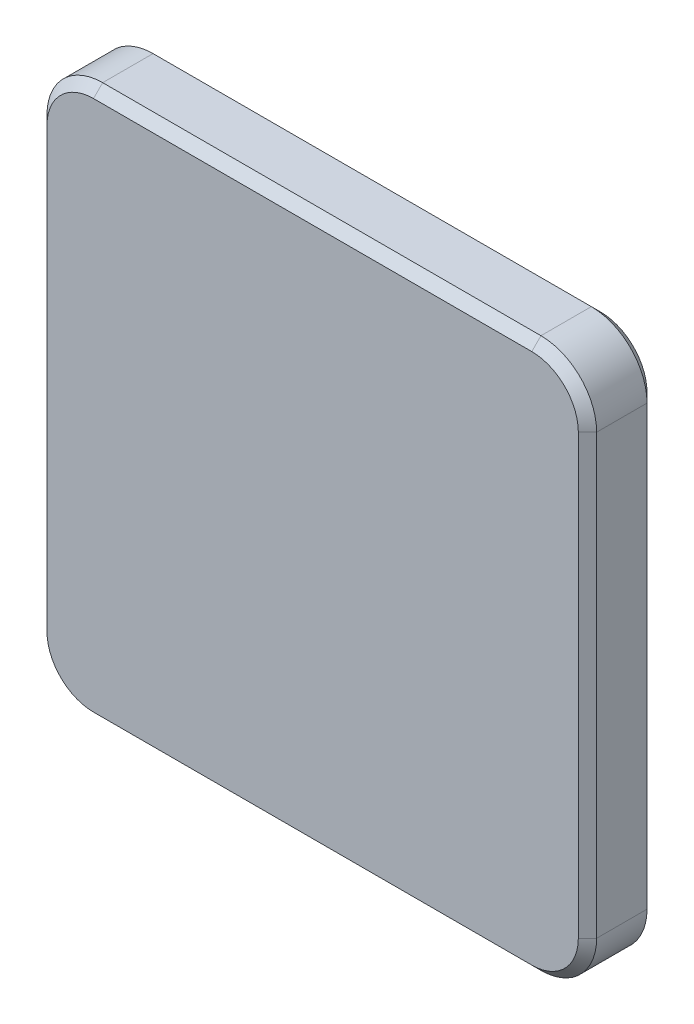
from build123d import *

# Parameters (mm, degrees)
SKETCH3_W                         = 101.6
SKETCH3_H                         = 12.7
BOSS_EXTRUDE1_DEPTH               = 50.8
BASEBORDERRADIUSSKETCH_OUTSIDE_W  = 132.436
BASEBORDERRADIUSSKETCH_OUTSIDE_H  = 132.436
BASEBORDERRADIUSCUT_EXTRUDE_DEPTH = 73.821966391
BASECHAMFER_SIZE                  = 1.5875
BUMPERTHREAD_PITCH                = 0.79375
BUMPERTHREADLPATTERN_COUNT        = 2
BUMPERTHREADLPATTERN_PITCH        = 76.2
BUMPERTHREADLPATTERN_COUNT_DIR2   = 2
BUMPERTHREADLPATTERN_PITCH_DIR2   = 76.2
BUMPERINSETSKETCH_R               = 6.35
BUMPERCUTS_DEPTH                  = 4.7625
LOGOCUTEXTRUDE_DEPTH              = 1.5875
CHAMFER1_SIZE                     = 0.396875


with BuildPart() as part:
    # Sketch3 → Boss-Extrude1 (new, symmetric)
    with BuildSketch(Plane(origin=(0, 0, 0), x_dir=(1, 0, 0), z_dir=(0, 1, 0))):
        Rectangle(SKETCH3_W, SKETCH3_H)
    extrude(amount=BOSS_EXTRUDE1_DEPTH, both=True)

    # FacingBottomSurfaceCut
    split(bisect_by=Plane(origin=(0, 0, -5.953125), x_dir=(1, 0, 0), z_dir=(0, 0, -1)), keep=Keep.BOTTOM)

    # FacingTopSurfaceCut
    split(bisect_by=Plane(origin=(0, 0, 5.953125), x_dir=(-1, 0, 0), z_dir=(0, 0, 1)), keep=Keep.BOTTOM)

    # BaseBorderRadiusSketch outside → BaseBorderRadiusCut-Extrude (cut, through all)
    with BuildSketch(Plane(origin=(0, 0, -5.953125), x_dir=(1, 0, 0), z_dir=(0, 0, -1))):
        Rectangle(BASEBORDERRADIUSSKETCH_OUTSIDE_W, BASEBORDERRADIUSSKETCH_OUTSIDE_H)
        with BuildLine():
            Line((-47.625, 37.973), (-47.625, -37.973))
            ThreePointArc((-47.625, -37.973), (-44.797994652, -44.797994652), (-37.973, -47.625))
            Line((-37.973, -47.625), (37.973, -47.625))
            ThreePointArc((37.973, -47.625), (44.797994652, -44.797994652), (47.625, -37.973))
            Line((47.625, -37.973), (47.625, 37.973))
            ThreePointArc((47.625, 37.973), (44.797994652, 44.797994652), (37.973, 47.625))
            Line((37.973, 47.625), (-37.973, 47.625))
            ThreePointArc((-37.973, 47.625), (-44.797994652, 44.797994652), (-47.625, 37.973))
        make_face(mode=Mode.SUBTRACT)
    extrude(amount=-BASEBORDERRADIUSCUT_EXTRUDE_DEPTH, mode=Mode.SUBTRACT)

    # BaseChamfer
    basechamfer_edges = [part.edges().sort_by_distance(p)[0] for p in [
        (0, -47.625, 5.953125),
        (-44.797994652, -44.797994652, 5.953125),
        (-47.625, 0, 5.953125),
        (-44.797994652, 44.797994652, 5.953125),
        (0, 47.625, 5.953125),
        (44.797994652, 44.797994652, 5.953125),
        (47.625, 0, 5.953125),
        (44.797994652, -44.797994652, 5.953125),
        (-44.797994652, -44.797994652, -5.953125),
        (0, -47.625, -5.953125),
        (44.797994652, -44.797994652, -5.953125),
        (47.625, 0, -5.953125),
        (44.797994652, 44.797994652, -5.953125),
        (0, 47.625, -5.953125),
        (-44.797994652, 44.797994652, -5.953125),
        (-47.625, 0, -5.953125),
    ]]
    chamfer(basechamfer_edges, length=BASECHAMFER_SIZE)

    # Sketch11 → Bumper#6-32 Tapped Hole (revolve, cut)
    with BuildSketch(Plane(origin=(-38.1, 38.1, -5.953125), x_dir=(0, 1, 0), z_dir=(1, 0, 0))):
        Polygon((0, 0), (0, 9.54394403), (1.35255, 8.73125), (1.35255, 0), align=None)
    bumper_6_32_tapped_hole = revolve(axis=Axis((-38.1, 38.1, -12.303125), (0, 0, 1)), mode=Mode.SUBTRACT)

    # BumperThread: the profile of Thread Profile1 profile screwed along a right-hand helix of 12 turns, 8 arcs to a turn; built about Z, then put on its axis
    bumperthread_z = Axis((0, 0, 0), (0, 0, 1))
    bumperthread_corners = [(1.35225, 0, -0.000173205), (1.782179788, 0, 0.248046874), (1.782179788, 0, 0.347265624), (1.35225, 0, 0.595485703)]
    with BuildLine(mode=Mode.PRIVATE) as bumperthread_profile:
        Line(bumperthread_corners[0], bumperthread_corners[1])
        Line(bumperthread_corners[1], bumperthread_corners[2])
        Line(bumperthread_corners[2], bumperthread_corners[3])
        Line(bumperthread_corners[3], bumperthread_corners[0])
    bumperthread_cap = Face(bumperthread_profile.wire())
    bumperthread_turn_angles = [0, 22.5, 45, 67.5, 90, 112.5, 135, 157.5, 180, 202.5, 225, 247.5, 270, 292.5, 315, 337.5, 360]
    bumperthread_turn_weights = [1, 0.9238795325112867, 1, 0.9238795325112867, 1, 0.9238795325112867, 1, 0.9238795325112867, 1, 0.9238795325112867, 1, 0.9238795325112867, 1, 0.9238795325112867, 1, 0.9238795325112867, 1]
    bumperthread_turn_rails = [Edge.make_bspline([Vector(p[0], p[1], 0).rotate(bumperthread_z, bumperthread_turn_angles[k]) / bumperthread_turn_weights[k] + Vector(0, 0, p[2] + BUMPERTHREAD_PITCH * bumperthread_turn_angles[k] / 360) for k in range(17)], [0, 0, 0, 1, 1, 2, 2, 3, 3, 4, 4, 5, 5, 6, 6, 7, 7, 8, 8, 8], 2, bumperthread_turn_weights) for p in bumperthread_corners]
    bumperthread_turn_sides = [Face.make_surface_from_curves(bumperthread_turn_rails[p[0]], bumperthread_turn_rails[p[1]]) for p in [(0, 1), (1, 2), (2, 3), (3, 0)]]
    bumperthread = Plane(origin=(-38.1, 38.1, -6.746875), x_dir=(1, 0, 0), z_dir=(0, 0, 1)) * Solid(Shell([*[p.moved(Location((0, 0, BUMPERTHREAD_PITCH * i))) for i in range(12) for p in bumperthread_turn_sides], bumperthread_cap, bumperthread_cap.rotate(bumperthread_z, 4320).moved(Location((0, 0, BUMPERTHREAD_PITCH * 4320 / 360)))]))
    add(bumperthread, mode=Mode.SUBTRACT)

    # BumperThreadLPattern: Bumper#6-32 Tapped Hole, BumperThread 2 × 2
    with Locations(*[(i * BUMPERTHREADLPATTERN_PITCH, -j * BUMPERTHREADLPATTERN_PITCH_DIR2, 0) for i in range(BUMPERTHREADLPATTERN_COUNT) for j in range(BUMPERTHREADLPATTERN_COUNT_DIR2) if (i, j) != (0, 0)]):
        add(bumper_6_32_tapped_hole, mode=Mode.SUBTRACT)
        add(bumperthread, mode=Mode.SUBTRACT)

    # BumperInsetSketch → BumperCuts (cut)
    with BuildSketch(Plane.XY.offset(-5.953125)):
        with Locations(Location((-38.1, 38.1, 0), (0, 0, 180))):
            Circle(BUMPERINSETSKETCH_R)
        with Locations(Location((38.1, 38.1, 0), (0, 0, 180))):
            Circle(BUMPERINSETSKETCH_R)
        with Locations(Location((38.1, -38.1, 0), (0, 0, 180))):
            Circle(BUMPERINSETSKETCH_R)
        with Locations(Location((-38.1, -38.1, 0), (0, 0, 180))):
            Circle(BUMPERINSETSKETCH_R)
    extrude(amount=BUMPERCUTS_DEPTH, mode=Mode.SUBTRACT)

    # LogoSketch → LogoCutExtrude (cut)
    # profile 1 of 5: a face of its own
    with BuildSketch(Plane.XY.offset(-5.953125)):
        with BuildLine():
            Line((4.533680299, -4.248779361), (-4.533680299, -4.248779361))
            ThreePointArc((-4.533680299, -4.248779361), (-6.217478322, -3.551327384), (-6.914930299, -1.867529361))
            Line((-6.914930299, -1.867529361), (-6.914930299, 1.965294255))
            ThreePointArc((-6.914930299, 1.965294255), (-6.217478322, 3.649092278), (-4.533680299, 4.346544255))
            Line((-4.533680299, 4.346544255), (4.533680299, 4.346544255))
            ThreePointArc((4.533680299, 4.346544255), (6.217478322, 3.649092278), (6.914930299, 1.965294255))
            Line((6.914930299, 1.965294255), (6.914930299, -1.867529361))
            ThreePointArc((6.914930299, -1.867529361), (6.217478322, -3.551327384), (4.533680299, -4.248779361))
        make_face()
        with BuildLine():
            Line((4.533680299, -3.455029361), (-4.533680299, -3.455029361))
            ThreePointArc((-4.533680299, -3.455029361), (-5.656212314, -2.990061376), (-6.121180299, -1.867529361))
            Line((-6.121180299, -1.867529361), (-6.121180299, 1.965294255))
            ThreePointArc((-6.121180299, 1.965294255), (-5.656212314, 3.08782627), (-4.533680299, 3.552794255))
            Line((-4.533680299, 3.552794255), (4.533680299, 3.552794255))
            ThreePointArc((4.533680299, 3.552794255), (5.656212314, 3.08782627), (6.121180299, 1.965294255))
            Line((6.121180299, 1.965294255), (6.121180299, -1.867529361))
            ThreePointArc((6.121180299, -1.867529361), (5.656212314, -2.990061376), (4.533680299, -3.455029361))
        make_face(mode=Mode.SUBTRACT)
    # profile 2 of 5: a face of its own
    with BuildSketch(Plane.XY.offset(-5.953125)):
        with BuildLine():
            Line((-4.084958262, 0.465465281), (-3.745847603, 0.217418406))
            Line((-3.745847603, 0.217418406), (-4.107384418, -0.317411431))
            add(Edge.make_bspline(
                [(-4.107384418, -0.317411431), (-4.117731467, -0.333055261), (-4.136865481, -0.361984212), (-4.158090193, -0.405326), (-4.172527983, -0.444038294), (-4.174461041, -0.469088497), (-4.175342466, -0.480510747)],
                knots=[0, 0, 0, 0, 0.313971844, 0.580604376, 0.808766356, 1, 1, 1, 1], degree=3))
            add(Edge.make_bspline(
                [(-4.175342466, -0.480510747), (-4.174372616, -0.497202362), (-4.172433547, -0.530574757), (-4.154090327, -0.57858004), (-4.125328234, -0.62349711), (-4.087260419, -0.664557891), (-4.042311595, -0.699569508), (-3.993277146, -0.725891806), (-3.94068621, -0.741559074), (-3.904745079, -0.743754394), (-3.886520762, -0.744867553)],
                knots=[0, 0, 0, 0, 0.116072961, 0.232070568, 0.353538763, 0.486654939, 0.620706194, 0.749385024, 0.872923124, 1, 1, 1, 1], degree=3))
            add(Edge.make_bspline(
                [(-3.886520762, -0.744867553), (-3.870661023, -0.743795189), (-3.838879432, -0.74164626), (-3.794253595, -0.720437767), (-3.75207772, -0.689440793), (-3.729786672, -0.660808178), (-3.717984803, -0.645648803)],
                knots=[0, 0, 0, 0, 0.232858362, 0.466628673, 0.717609594, 1, 1, 1, 1], degree=3))
            Line((-3.717984803, -0.645648803), (-3.690122003, -0.606233135))
            Line((-3.690122003, -0.606233135), (-3.153933005, 0.156256163))
            Line((-3.153933005, 0.156256163), (-2.898410745, -0.452647947))
            add(Edge.make_bspline(
                [(-2.898410745, -0.452647947), (-2.888024277, -0.475772536), (-2.86817581, -0.519963461), (-2.831841489, -0.579846527), (-2.791903006, -0.630388935), (-2.748285392, -0.672080262), (-2.701393576, -0.705662229), (-2.649542781, -0.72775488), (-2.594742342, -0.7422332), (-2.556903487, -0.743976214), (-2.53755351, -0.744867553)],
                knots=[0, 0, 0, 0, 0.15358312, 0.29349625, 0.423478163, 0.542965227, 0.6584056, 0.770941816, 0.882864567, 1, 1, 1, 1], degree=3))
            add(Edge.make_bspline(
                [(-2.53755351, -0.744867553), (-2.521871125, -0.743993454), (-2.491251454, -0.742286786), (-2.446927306, -0.731577769), (-2.407120441, -0.711926975), (-2.371562303, -0.686296898), (-2.342444824, -0.654546062), (-2.321085127, -0.618688258), (-2.307125895, -0.579591782), (-2.305807832, -0.552210937), (-2.305136986, -0.538275087)],
                knots=[0, 0, 0, 0, 0.136148641, 0.265828609, 0.392432725, 0.519036841, 0.644259947, 0.763265011, 0.879510543, 1, 1, 1, 1], degree=3))
            add(Edge.make_bspline(
                [(-2.305136986, -0.538275087), (-2.305464465, -0.526906054), (-2.306158645, -0.502806313), (-2.314632812, -0.466165493), (-2.325131743, -0.426317526), (-2.336055885, -0.399980385), (-2.341834332, -0.38604906)],
                knots=[0, 0, 0, 0, 0.216030294, 0.457934648, 0.713268464, 1, 1, 1, 1], degree=3))
            Line((-2.341834332, -0.38604906), (-2.36765839, -0.324886817))
            Line((-2.36765839, -0.324886817), (-3.357127568, 2.071313954))
            Line((-3.357127568, 2.071313954), (-3.382272046, 2.132476197))
            add(Edge.make_bspline(
                [(-3.382272046, 2.132476197), (-3.391301945, 2.152656351), (-3.408656071, 2.191439617), (-3.441527855, 2.243612452), (-3.478610894, 2.287691587), (-3.519221938, 2.324305223), (-3.564704183, 2.351721429), (-3.613147041, 2.372812299), (-3.666498429, 2.384222401), (-3.703211611, 2.385819337), (-3.722062286, 2.386639296)],
                knots=[0, 0, 0, 0, 0.146264449, 0.281098591, 0.406705968, 0.526791125, 0.64127443, 0.756892036, 0.875174279, 1, 1, 1, 1], degree=3))
            add(Edge.make_bspline(
                [(-3.722062286, 2.386639296), (-3.737782144, 2.385906791), (-3.768591504, 2.384471155), (-3.812594616, 2.371678636), (-3.853400851, 2.351552349), (-3.889217265, 2.323149541), (-3.919704575, 2.2898136), (-3.942390739, 2.252085808), (-3.955730991, 2.210603925), (-3.957156452, 2.181726215), (-3.957876712, 2.167134801)],
                knots=[0, 0, 0, 0, 0.131610018, 0.257942557, 0.381164227, 0.511159338, 0.638983625, 0.758259388, 0.877852595, 1, 1, 1, 1], degree=3))
            add(Edge.make_bspline(
                [(-3.957876712, 2.167134801), (-3.957541367, 2.155316969), (-3.956832271, 2.130327859), (-3.948489753, 2.091997072), (-3.937040367, 2.050560236), (-3.926203391, 2.022749847), (-3.920499786, 2.008112969)],
                knots=[0, 0, 0, 0, 0.215420924, 0.455513061, 0.713431243, 1, 1, 1, 1], degree=3))
            Line((-3.920499786, 2.008112969), (-3.893996147, 1.945591565))
            Line((-3.893996147, 1.945591565), (-3.293926584, 0.496725983))
            Line((-3.293926584, 0.496725983), (-3.807689426, 0.876611471))
            add(Edge.make_bspline(
                [(-3.807689426, 0.876611471), (-3.833167937, 0.894380442), (-3.880688749, 0.927521936), (-3.952251465, 0.965833269), (-4.018940223, 0.989482182), (-4.062155899, 0.993152658), (-4.08223994, 0.994858474)],
                knots=[0, 0, 0, 0, 0.306944426, 0.572492185, 0.801320142, 1, 1, 1, 1], degree=3))
            add(Edge.make_bspline(
                [(-4.08223994, 0.994858474), (-4.097731555, 0.994112488), (-4.127593803, 0.992674494), (-4.170220235, 0.980464788), (-4.209105934, 0.961411467), (-4.242723746, 0.934076019), (-4.270541152, 0.901567694), (-4.29170614, 0.865166073), (-4.303484378, 0.824310283), (-4.305026905, 0.796040406), (-4.305821918, 0.781470204)],
                knots=[0, 0, 0, 0, 0.134648954, 0.259554642, 0.38305069, 0.509350284, 0.633866005, 0.7539924, 0.873208487, 1, 1, 1, 1], degree=3))
            add(Edge.make_bspline(
                [(-4.305821918, 0.781470204), (-4.305237015, 0.768756554), (-4.304077979, 0.743563335), (-4.296618286, 0.706042451), (-4.282414772, 0.670042666), (-4.264297503, 0.63434281), (-4.239847705, 0.600402936), (-4.211173134, 0.566547579), (-4.176317414, 0.534273408), (-4.150570297, 0.513988088), (-4.137285959, 0.503521788)],
                knots=[0, 0, 0, 0, 0.113020134, 0.223959355, 0.337996824, 0.455947278, 0.578811618, 0.708729884, 0.849717907, 1, 1, 1, 1], degree=3))
            Line((-4.137285959, 0.503521788), (-4.084958262, 0.465465281))
        make_face()
    # profile 3 of 5: a face of its own
    with BuildSketch(Plane.XY.offset(-5.953125)):
        with BuildLine():
            Line((-2.06932256, 0.569441094), (-1.738366866, -0.222949745))
            Line((-1.738366866, -0.222949745), (-1.991170805, -0.222949745))
            add(Edge.make_bspline(
                [(-1.991170805, -0.222949745), (-2.012261745, -0.223614367), (-2.051967692, -0.224865588), (-2.107932023, -0.233699595), (-2.155042169, -0.250927315), (-2.195039525, -0.273057248), (-2.224928718, -0.304187833), (-2.246605123, -0.341402353), (-2.259854044, -0.385409387), (-2.261026321, -0.416986146), (-2.261643836, -0.433619693)],
                knots=[0, 0, 0, 0, 0.16177683, 0.304562154, 0.432041489, 0.544948255, 0.651814255, 0.758468289, 0.872769429, 1, 1, 1, 1], degree=3))
            add(Edge.make_bspline(
                [(-2.261643836, -0.433619693), (-2.260574247, -0.456848764), (-2.258523163, -0.50139372), (-2.23990385, -0.564493138), (-2.20749446, -0.618690443), (-2.164182697, -0.665039749), (-2.109504243, -0.701011302), (-2.045469958, -0.727369436), (-1.97186017, -0.741707301), (-1.919873825, -0.743780922), (-1.892631635, -0.744867553)],
                knots=[0, 0, 0, 0, 0.127508382, 0.24451496, 0.357276616, 0.471798467, 0.590260399, 0.71421068, 0.850239002, 1, 1, 1, 1], degree=3))
            Line((-1.892631635, -0.744867553), (-1.599052868, -0.744867553))
            add(Edge.make_bspline(
                [(-1.599052868, -0.744867553), (-1.583165866, -0.744339258), (-1.552787886, -0.743329089), (-1.509061489, -0.735828386), (-1.469193378, -0.722861107), (-1.433055447, -0.704675148), (-1.401243716, -0.680875451), (-1.372931876, -0.652810736), (-1.348777237, -0.61903244), (-1.336791698, -0.593539267), (-1.330618579, -0.580409077)],
                knots=[0, 0, 0, 0, 0.141950326, 0.271427171, 0.394991637, 0.515414617, 0.631222228, 0.748611744, 0.870523154, 1, 1, 1, 1], degree=3))
            add(Edge.make_bspline(
                [(-1.330618579, -0.580409077), (-1.303092922, -0.605480247), (-1.25122861, -0.652719773), (-1.165679324, -0.703749184), (-1.082025146, -0.738739646), (-1.025112655, -0.742871759), (-0.997624144, -0.744867553)],
                knots=[0, 0, 0, 0, 0.293088803, 0.552242928, 0.783735081, 1, 1, 1, 1], degree=3))
            Line((-0.997624144, -0.744867553), (-0.73666524, -0.744867553))
            add(Edge.make_bspline(
                [(-0.73666524, -0.744867553), (-0.716019716, -0.744383468), (-0.675693018, -0.743437909), (-0.616768753, -0.734921786), (-0.560723626, -0.721805491), (-0.508201371, -0.701465759), (-0.458248902, -0.677275018), (-0.411437064, -0.646953206), (-0.368243825, -0.610798827), (-0.327860807, -0.570072775), (-0.292228616, -0.524332745), (-0.259885986, -0.47561422), (-0.233475084, -0.422749085), (-0.211603938, -0.366794273), (-0.194817397, -0.307593753), (-0.182236151, -0.245155443), (-0.175845528, -0.179136168), (-0.174606357, -0.133935914), (-0.173972603, -0.110818966)],
                knots=[0, 0, 0, 0, 0.064930069, 0.126827266, 0.186992731, 0.245644302, 0.303664373, 0.361399116, 0.420632584, 0.480616195, 0.541511982, 0.602802836, 0.664329512, 0.727074656, 0.791600441, 0.85772469, 0.927235563, 1, 1, 1, 1], degree=3))
            add(Edge.make_bspline(
                [(-0.173972603, -0.110818966), (-0.174853745, -0.075429905), (-0.176595129, -0.005491134), (-0.191518028, 0.098023373), (-0.215061214, 0.198657112), (-0.248638026, 0.296515713), (-0.29190203, 0.391114188), (-0.343356721, 0.483536359), (-0.406193024, 0.572025717), (-0.476373516, 0.657217042), (-0.552758576, 0.735622045), (-0.632390958, 0.8051105), (-0.715411891, 0.863016182), (-0.800001218, 0.91194452), (-0.888067553, 0.948768136), (-0.978208457, 0.975621002), (-1.071134385, 0.991568411), (-1.133933709, 0.993758366), (-1.165480522, 0.994858474)],
                knots=[0, 0, 0, 0, 0.064899591, 0.128259907, 0.191466009, 0.254289735, 0.317715443, 0.382102007, 0.448052352, 0.516537672, 0.584428982, 0.648666486, 0.710122622, 0.769868617, 0.827606285, 0.884810481, 0.942135329, 1, 1, 1, 1], degree=3))
            add(Edge.make_bspline(
                [(-1.165480522, 0.994858474), (-1.189050512, 0.994275744), (-1.234728607, 0.993146427), (-1.301102062, 0.986191867), (-1.362227976, 0.971930738), (-1.419289185, 0.955184555), (-1.470522442, 0.930757218), (-1.5172642, 0.902185152), (-1.559393603, 0.86830084), (-1.582676766, 0.841203907), (-1.594295805, 0.827681676)],
                knots=[0, 0, 0, 0, 0.148468646, 0.287728801, 0.419248222, 0.543323395, 0.661389628, 0.775404861, 0.887919887, 1, 1, 1, 1], degree=3))
            add(Edge.make_bspline(
                [(-1.594295805, 0.827681676), (-1.603978574, 0.841046504), (-1.622788301, 0.867008988), (-1.654989558, 0.901214706), (-1.689429541, 0.930141794), (-1.725886137, 0.954329991), (-1.765485816, 0.971609185), (-1.806149221, 0.985917655), (-1.849792054, 0.993150595), (-1.879471953, 0.994280087), (-1.894670377, 0.994858474)],
                knots=[0, 0, 0, 0, 0.137870178, 0.267826301, 0.391489649, 0.513356339, 0.632002101, 0.751776058, 0.872889977, 1, 1, 1, 1], degree=3))
            add(Edge.make_bspline(
                [(-1.894670377, 0.994858474), (-1.91081185, 0.994031004), (-1.942392796, 0.992412049), (-1.987686731, 0.981094062), (-2.028207979, 0.960438155), (-2.063799757, 0.933484791), (-2.094147349, 0.901271046), (-2.115350777, 0.863646731), (-2.129238341, 0.822522828), (-2.13051139, 0.793591699), (-2.131164384, 0.778751882)],
                knots=[0, 0, 0, 0, 0.135644011, 0.265388793, 0.388835651, 0.515241477, 0.639201021, 0.757735568, 0.87573386, 1, 1, 1, 1], degree=3))
            add(Edge.make_bspline(
                [(-2.131164384, 0.778751882), (-2.130766664, 0.767848645), (-2.129922918, 0.744717857), (-2.122563038, 0.708742313), (-2.111017026, 0.669831319), (-2.100159415, 0.643649985), (-2.094467038, 0.629923757)],
                knots=[0, 0, 0, 0, 0.211809046, 0.449344558, 0.711304932, 1, 1, 1, 1], degree=3))
            Line((-2.094467038, 0.629923757), (-2.06932256, 0.569441094))
        make_face()
        with BuildLine():
            Line((-0.905880779, -0.222949745), (-0.96364512, -0.222949745))
            add(Edge.make_bspline(
                [(-0.96364512, -0.222949745), (-0.978168715, -0.222631321), (-1.006257308, -0.222015491), (-1.046542144, -0.215250122), (-1.082856532, -0.203636622), (-1.115573692, -0.187899456), (-1.144213283, -0.167355858), (-1.169239162, -0.142515717), (-1.189910289, -0.112673514), (-1.20024359, -0.090381691), (-1.205575771, -0.078878683)],
                knots=[0, 0, 0, 0, 0.144708006, 0.279864879, 0.405576864, 0.523759235, 0.640333608, 0.755321861, 0.873741395, 1, 1, 1, 1], degree=3))
            Line((-1.205575771, -0.078878683), (-1.36052012, 0.29353142))
            add(Edge.make_bspline(
                [(-1.36052012, 0.29353142), (-1.369777667, 0.315635982), (-1.386241975, 0.354948378), (-1.390094496, 0.39731234), (-1.391780822, 0.415855906)],
                knots=[0, 0, 0, 0, 0.562279724, 1, 1, 1, 1], degree=3))
            add(Edge.make_bspline(
                [(-1.391780822, 0.415855906), (-1.390857163, 0.425219907), (-1.388993846, 0.444110115), (-1.377909266, 0.47183204), (-1.356678602, 0.495466214), (-1.330565365, 0.517717391), (-1.298937187, 0.536561401), (-1.263278599, 0.550051131), (-1.224544811, 0.558530079), (-1.197692844, 0.559451328), (-1.183829195, 0.559926967)],
                knots=[0, 0, 0, 0, 0.101322931, 0.204401009, 0.315545453, 0.440468581, 0.574243888, 0.710477244, 0.850519636, 1, 1, 1, 1], degree=3))
            add(Edge.make_bspline(
                [(-1.183829195, 0.559926967), (-1.169736633, 0.559450995), (-1.141274926, 0.558489708), (-1.099067233, 0.549064601), (-1.057314148, 0.534778211), (-1.015881853, 0.514546017), (-0.974746438, 0.488722047), (-0.933609884, 0.457288239), (-0.893723108, 0.419390912), (-0.841383034, 0.363799258), (-0.784852133, 0.288869668), (-0.734154155, 0.194150844), (-0.702006333, 0.097135807), (-0.697915125, 0.031216543), (-0.695890411, -0.001406509)],
                knots=[0, 0, 0, 0, 0.052308876, 0.10564437, 0.159960995, 0.216068651, 0.276577223, 0.340231538, 0.408142326, 0.480813116, 0.623943112, 0.75538574, 0.87894186, 1, 1, 1, 1], degree=3))
            add(Edge.make_bspline(
                [(-0.695890411, -0.001406509), (-0.69654243, -0.018666283), (-0.697780402, -0.05143701), (-0.706927651, -0.097342093), (-0.723095962, -0.136599969), (-0.747187422, -0.168379045), (-0.777721168, -0.193232977), (-0.814823848, -0.211332767), (-0.85848378, -0.221216562), (-0.889521748, -0.222351538), (-0.905880779, -0.222949745)],
                knots=[0, 0, 0, 0, 0.147961661, 0.280931323, 0.399290449, 0.508857407, 0.619299198, 0.733982228, 0.859791306, 1, 1, 1, 1], degree=3))
        make_face(mode=Mode.SUBTRACT)
    # profile 4 of 5: a face of its own
    with BuildSketch(Plane.XY.offset(-5.953125)):
        with BuildLine():
            Line((2.50833155, -1.894717724), (1.397217466, 0.791663911))
            add(Edge.make_bspline(
                [(1.397217466, 0.791663911), (1.389925601, 0.807732566), (1.375798676, 0.838863241), (1.348515852, 0.880704416), (1.316850312, 0.91572422), (1.281770199, 0.944867184), (1.242610268, 0.967719113), (1.199020125, 0.983188327), (1.151862068, 0.992899371), (1.119091349, 0.994194207), (1.102279538, 0.994858474)],
                knots=[0, 0, 0, 0, 0.138219588, 0.267780289, 0.389766178, 0.507112312, 0.624094956, 0.743215423, 0.86826612, 1, 1, 1, 1], degree=3))
            add(Edge.make_bspline(
                [(1.102279538, 0.994858474), (1.079160683, 0.993135457), (1.033739993, 0.989750314), (0.969556035, 0.963361418), (0.913920845, 0.918657584), (0.886348355, 0.879027153), (0.871901755, 0.858262798)],
                knots=[0, 0, 0, 0, 0.246973932, 0.48521981, 0.73028104, 1, 1, 1, 1], degree=3))
            add(Edge.make_bspline(
                [(0.871901755, 0.858262798), (0.844768465, 0.879348197), (0.790744969, 0.921330092), (0.696280719, 0.963956815), (0.593541964, 0.98995192), (0.522081067, 0.993188828), (0.485220462, 0.994858474)],
                knots=[0, 0, 0, 0, 0.245438029, 0.488677192, 0.736252012, 1, 1, 1, 1], degree=3))
            add(Edge.make_bspline(
                [(0.485220462, 0.994858474), (0.46594087, 0.994339041), (0.428108969, 0.99331977), (0.372617776, 0.985211606), (0.320377392, 0.970686118), (0.270457212, 0.951640283), (0.223762422, 0.926392169), (0.179606516, 0.895747944), (0.139817817, 0.858202807), (0.101457189, 0.817305492), (0.067893467, 0.770852479), (0.037723503, 0.721261097), (0.012520096, 0.667942438), (-0.007827676, 0.610967127), (-0.024193619, 0.550557225), (-0.035583362, 0.48643375), (-0.042541095, 0.418956752), (-0.043171115, 0.372833145), (-0.043493151, 0.349257019)],
                knots=[0, 0, 0, 0, 0.061714308, 0.121100569, 0.178984271, 0.235011739, 0.291794542, 0.348535646, 0.406541893, 0.466597514, 0.527811202, 0.5896277, 0.652238918, 0.716245913, 0.783098682, 0.852377908, 0.924542825, 1, 1, 1, 1], degree=3))
            add(Edge.make_bspline(
                [(-0.043493151, 0.349257019), (-0.04249627, 0.304578621), (-0.040541119, 0.216952343), (-0.023787126, 0.08865808), (0.003050526, -0.033412166), (0.041521572, -0.14923051), (0.090206432, -0.258674998), (0.150193931, -0.361779856), (0.220532598, -0.458881458), (0.275901829, -0.517116748), (0.303772474, -0.546430053)],
                knots=[0, 0, 0, 0, 0.13575741, 0.266256558, 0.392548012, 0.515136191, 0.636574194, 0.755972731, 0.87716648, 1, 1, 1, 1], degree=3))
            add(Edge.make_bspline(
                [(0.303772474, -0.546430053), (0.322712792, -0.564231109), (0.359224281, -0.598546431), (0.417494541, -0.642694543), (0.476802012, -0.677571995), (0.538706226, -0.704677319), (0.607415277, -0.723146956), (0.686008312, -0.735356931), (0.776362173, -0.743601454), (0.840620238, -0.744429449), (0.874620077, -0.744867553)],
                knots=[0, 0, 0, 0, 0.124849688, 0.240674322, 0.350453258, 0.454797631, 0.564403721, 0.691286987, 0.836655633, 1, 1, 1, 1], degree=3))
            add(Edge.make_bspline(
                [(0.874620077, -0.744867553), (0.91019889, -0.744582603), (0.975529032, -0.744059376), (1.064440999, -0.737901296), (1.135837562, -0.729567328), (1.192736788, -0.715256338), (1.240518653, -0.692323153), (1.284957916, -0.659817354), (1.330687462, -0.618241194), (1.359078202, -0.585064725), (1.374111729, -0.567497048)],
                knots=[0, 0, 0, 0, 0.191899311, 0.352367264, 0.48060847, 0.579323834, 0.667329523, 0.764643085, 0.875373281, 1, 1, 1, 1], degree=3))
            Line((1.374111729, -0.567497048), (1.976899615, -2.011605567))
            add(Edge.make_bspline(
                [(1.976899615, -2.011605567), (1.987499405, -2.035192476), (2.007773353, -2.080306554), (2.0448964, -2.141289455), (2.084789378, -2.193502327), (2.128646393, -2.236560548), (2.176721868, -2.269727775), (2.228582091, -2.292969924), (2.283899339, -2.308124201), (2.322252292, -2.309777067), (2.341834332, -2.310620978)],
                knots=[0, 0, 0, 0, 0.154199472, 0.29493339, 0.425004058, 0.545467284, 0.660211577, 0.771536168, 0.88335219, 1, 1, 1, 1], degree=3))
            add(Edge.make_bspline(
                [(2.341834332, -2.310620978), (2.356848108, -2.309779646), (2.385929718, -2.308149989), (2.428140366, -2.29705408), (2.466316789, -2.277504005), (2.500902934, -2.252078036), (2.529368058, -2.220790099), (2.551023666, -2.18598306), (2.563822282, -2.147470978), (2.565331864, -2.120883046), (2.56609589, -2.107426414)],
                knots=[0, 0, 0, 0, 0.134228615, 0.260000177, 0.386811191, 0.515628199, 0.641790559, 0.762672354, 0.879884203, 1, 1, 1, 1], degree=3))
            add(Edge.make_bspline(
                [(2.56609589, -2.107426414), (2.565344351, -2.094008269), (2.563669049, -2.064097054), (2.55134191, -2.015300743), (2.532957439, -1.957770135), (2.516967991, -1.916830569), (2.50833155, -1.894717724)],
                knots=[0, 0, 0, 0, 0.181669741, 0.404971235, 0.678604841, 1, 1, 1, 1], degree=3))
        make_face()
        with BuildLine():
            Line((1.036360231, 0.252756591), (1.186547517, -0.10334358))
            add(Edge.make_bspline(
                [(1.186547517, -0.10334358), (1.177644504, -0.119223421), (1.161132053, -0.148675822), (1.132663675, -0.186035017), (1.106828316, -0.215993146), (1.079262458, -0.237958148), (1.047083776, -0.250719862), (1.009707659, -0.260409067), (0.964894053, -0.265212603), (0.932617412, -0.266014833), (0.915394906, -0.266442896)],
                knots=[0, 0, 0, 0, 0.16021322, 0.297148058, 0.413026578, 0.50844475, 0.604113145, 0.715467648, 0.848176265, 1, 1, 1, 1], degree=3))
            add(Edge.make_bspline(
                [(0.915394906, -0.266442896), (0.889579781, -0.265207436), (0.840036625, -0.2628364), (0.770745011, -0.238945607), (0.709158931, -0.202281411), (0.678261533, -0.166396186), (0.662590967, -0.148195892)],
                knots=[0, 0, 0, 0, 0.266721268, 0.511878737, 0.752434302, 1, 1, 1, 1], degree=3))
            add(Edge.make_bspline(
                [(0.662590967, -0.148195892), (0.647776108, -0.128483426), (0.618716677, -0.089817311), (0.581290004, -0.029066358), (0.550050826, 0.032220573), (0.524143627, 0.09352841), (0.503122377, 0.155149794), (0.489351459, 0.217637028), (0.479811132, 0.280326718), (0.478885436, 0.322265263), (0.478424658, 0.343140795)],
                knots=[0, 0, 0, 0, 0.138360254, 0.27139443, 0.399915976, 0.524138605, 0.644769002, 0.764761049, 0.882906328, 1, 1, 1, 1], degree=3))
            add(Edge.make_bspline(
                [(0.478424658, 0.343140795), (0.47906884, 0.360171728), (0.480282853, 0.392267847), (0.489378746, 0.437127616), (0.5060132, 0.475216425), (0.529480931, 0.506466852), (0.559713313, 0.531147602), (0.59687428, 0.548119073), (0.640309168, 0.558256602), (0.671366309, 0.559350442), (0.687735445, 0.559926967)],
                knots=[0, 0, 0, 0, 0.147927924, 0.278781681, 0.395077221, 0.506073335, 0.61518668, 0.730512376, 0.857962468, 1, 1, 1, 1], degree=3))
            add(Edge.make_bspline(
                [(0.687735445, 0.559926967), (0.706385369, 0.55921231), (0.742530766, 0.557827233), (0.794706672, 0.545046413), (0.842596735, 0.524469362), (0.887115679, 0.496258103), (0.926491325, 0.459036484), (0.961613275, 0.41371671), (0.992817472, 0.360679222), (1.009407132, 0.321386466), (1.018011558, 0.301006805)],
                knots=[0, 0, 0, 0, 0.124290436, 0.240887161, 0.356014472, 0.470913287, 0.590709802, 0.715605508, 0.852495372, 1, 1, 1, 1], degree=3))
            add(Edge.make_bspline(
                [(1.018011558, 0.301006805), (1.021429912, 0.292180026), (1.027644132, 0.27613384), (1.03365559, 0.260010645), (1.036360231, 0.252756591)],
                knots=[0, 0, 0, 0, 0.55008578, 1, 1, 1, 1], degree=3))
        make_face(mode=Mode.SUBTRACT)
    # profile 5 of 5: a face of its own
    with BuildSketch(Plane.XY.offset(-5.953125)):
        with BuildLine():
            Line((4.552509632, -1.894717724), (3.441395548, 0.791663911))
            add(Edge.make_bspline(
                [(3.441395548, 0.791663911), (3.434103683, 0.807732566), (3.419976758, 0.838863241), (3.392693934, 0.880704416), (3.361028395, 0.91572422), (3.325948281, 0.944867184), (3.286788351, 0.967719113), (3.243198207, 0.983188327), (3.19604015, 0.992899371), (3.163269431, 0.994194207), (3.14645762, 0.994858474)],
                knots=[0, 0, 0, 0, 0.138219588, 0.267780289, 0.389766178, 0.507112312, 0.624094956, 0.743215423, 0.86826612, 1, 1, 1, 1], degree=3))
            add(Edge.make_bspline(
                [(3.14645762, 0.994858474), (3.123338765, 0.993135457), (3.077918075, 0.989750314), (3.013734117, 0.963361418), (2.958098927, 0.918657584), (2.930526437, 0.879027153), (2.916079837, 0.858262798)],
                knots=[0, 0, 0, 0, 0.246973932, 0.48521981, 0.73028104, 1, 1, 1, 1], degree=3))
            add(Edge.make_bspline(
                [(2.916079837, 0.858262798), (2.888946547, 0.879348197), (2.834923051, 0.921330092), (2.740458801, 0.963956815), (2.637720046, 0.98995192), (2.566259149, 0.993188828), (2.529398545, 0.994858474)],
                knots=[0, 0, 0, 0, 0.245438029, 0.488677192, 0.736252012, 1, 1, 1, 1], degree=3))
            add(Edge.make_bspline(
                [(2.529398545, 0.994858474), (2.510118952, 0.994339041), (2.472287051, 0.99331977), (2.416795858, 0.985211606), (2.364555474, 0.970686118), (2.314635294, 0.951640283), (2.267940504, 0.926392169), (2.223784598, 0.895747944), (2.183995899, 0.858202807), (2.145635271, 0.817305492), (2.112071549, 0.770852479), (2.081901585, 0.721261097), (2.056698179, 0.667942438), (2.036350406, 0.610967127), (2.019984463, 0.550557225), (2.00859472, 0.48643375), (2.001636987, 0.418956752), (2.001006967, 0.372833145), (2.000684932, 0.349257019)],
                knots=[0, 0, 0, 0, 0.061714308, 0.121100569, 0.178984271, 0.235011739, 0.291794542, 0.348535646, 0.406541893, 0.466597514, 0.527811202, 0.5896277, 0.652238918, 0.716245913, 0.783098682, 0.852377908, 0.924542825, 1, 1, 1, 1], degree=3))
            add(Edge.make_bspline(
                [(2.000684932, 0.349257019), (2.001681813, 0.304578621), (2.003636963, 0.216952343), (2.020390956, 0.08865808), (2.047228608, -0.033412166), (2.085699654, -0.14923051), (2.134384514, -0.258674998), (2.194372013, -0.361779856), (2.26471068, -0.458881458), (2.320079911, -0.517116748), (2.347950557, -0.546430053)],
                knots=[0, 0, 0, 0, 0.13575741, 0.266256558, 0.392548012, 0.515136191, 0.636574194, 0.755972731, 0.87716648, 1, 1, 1, 1], degree=3))
            add(Edge.make_bspline(
                [(2.347950557, -0.546430053), (2.366890874, -0.564231109), (2.403402364, -0.598546431), (2.461672623, -0.642694543), (2.520980094, -0.677571995), (2.582884308, -0.704677319), (2.651593359, -0.723146956), (2.730186395, -0.735356931), (2.820540255, -0.743601454), (2.88479832, -0.744429449), (2.918798159, -0.744867553)],
                knots=[0, 0, 0, 0, 0.124849688, 0.240674322, 0.350453258, 0.454797631, 0.564403721, 0.691286987, 0.836655633, 1, 1, 1, 1], degree=3))
            add(Edge.make_bspline(
                [(2.918798159, -0.744867553), (2.954376973, -0.744582603), (3.019707114, -0.744059376), (3.108619081, -0.737901296), (3.180015644, -0.729567328), (3.23691487, -0.715256338), (3.284696735, -0.692323153), (3.329135999, -0.659817354), (3.374865545, -0.618241194), (3.403256284, -0.585064725), (3.418289812, -0.567497048)],
                knots=[0, 0, 0, 0, 0.191899311, 0.352367264, 0.48060847, 0.579323834, 0.667329523, 0.764643085, 0.875373281, 1, 1, 1, 1], degree=3))
            Line((3.418289812, -0.567497048), (4.021077697, -2.011605567))
            add(Edge.make_bspline(
                [(4.021077697, -2.011605567), (4.031677487, -2.035192476), (4.051951436, -2.080306554), (4.089074482, -2.141289455), (4.12896746, -2.193502327), (4.172824475, -2.236560548), (4.22089995, -2.269727775), (4.272760173, -2.292969924), (4.328077421, -2.308124201), (4.366430374, -2.309777067), (4.386012414, -2.310620978)],
                knots=[0, 0, 0, 0, 0.154199472, 0.29493339, 0.425004058, 0.545467284, 0.660211577, 0.771536168, 0.88335219, 1, 1, 1, 1], degree=3))
            add(Edge.make_bspline(
                [(4.386012414, -2.310620978), (4.40102619, -2.309779646), (4.4301078, -2.308149989), (4.472318448, -2.29705408), (4.510494872, -2.277504005), (4.545081016, -2.252078036), (4.57354614, -2.220790099), (4.595201748, -2.18598306), (4.608000364, -2.147470978), (4.609509946, -2.120883046), (4.610273973, -2.107426414)],
                knots=[0, 0, 0, 0, 0.134228615, 0.260000177, 0.386811191, 0.515628199, 0.641790559, 0.762672354, 0.879884203, 1, 1, 1, 1], degree=3))
            add(Edge.make_bspline(
                [(4.610273973, -2.107426414), (4.609522433, -2.094008269), (4.607847131, -2.064097054), (4.595519992, -2.015300743), (4.577135521, -1.957770135), (4.561146073, -1.916830569), (4.552509632, -1.894717724)],
                knots=[0, 0, 0, 0, 0.181669741, 0.404971235, 0.678604841, 1, 1, 1, 1], degree=3))
        make_face()
        with BuildLine():
            Line((3.080538313, 0.252756591), (3.230725599, -0.10334358))
            add(Edge.make_bspline(
                [(3.230725599, -0.10334358), (3.221822587, -0.119223421), (3.205310136, -0.148675822), (3.176841758, -0.186035017), (3.151006398, -0.215993146), (3.123440541, -0.237958148), (3.091261858, -0.250719862), (3.053885741, -0.260409067), (3.009072135, -0.265212603), (2.976795494, -0.266014833), (2.959572988, -0.266442896)],
                knots=[0, 0, 0, 0, 0.16021322, 0.297148058, 0.413026578, 0.50844475, 0.604113145, 0.715467648, 0.848176265, 1, 1, 1, 1], degree=3))
            add(Edge.make_bspline(
                [(2.959572988, -0.266442896), (2.933757863, -0.265207436), (2.884214707, -0.2628364), (2.814923093, -0.238945607), (2.753337014, -0.202281411), (2.722439615, -0.166396186), (2.70676905, -0.148195892)],
                knots=[0, 0, 0, 0, 0.266721268, 0.511878737, 0.752434302, 1, 1, 1, 1], degree=3))
            add(Edge.make_bspline(
                [(2.70676905, -0.148195892), (2.69195419, -0.128483426), (2.662894759, -0.089817311), (2.625468087, -0.029066358), (2.594228908, 0.032220573), (2.568321709, 0.09352841), (2.547300459, 0.155149794), (2.533529542, 0.217637028), (2.523989215, 0.280326718), (2.523063519, 0.322265263), (2.52260274, 0.343140795)],
                knots=[0, 0, 0, 0, 0.138360254, 0.27139443, 0.399915976, 0.524138605, 0.644769002, 0.764761049, 0.882906328, 1, 1, 1, 1], degree=3))
            add(Edge.make_bspline(
                [(2.52260274, 0.343140795), (2.523246923, 0.360171728), (2.524460936, 0.392267847), (2.533556828, 0.437127616), (2.550191282, 0.475216425), (2.573659013, 0.506466852), (2.603891395, 0.531147602), (2.641052363, 0.548119073), (2.68448725, 0.558256602), (2.715544391, 0.559350442), (2.731913527, 0.559926967)],
                knots=[0, 0, 0, 0, 0.147927924, 0.278781681, 0.395077221, 0.506073335, 0.61518668, 0.730512376, 0.857962468, 1, 1, 1, 1], degree=3))
            add(Edge.make_bspline(
                [(2.731913527, 0.559926967), (2.750563451, 0.55921231), (2.786708848, 0.557827233), (2.838884754, 0.545046413), (2.886774817, 0.524469362), (2.931293761, 0.496258103), (2.970669407, 0.459036484), (3.005791357, 0.41371671), (3.036995555, 0.360679222), (3.053585214, 0.321386466), (3.06218964, 0.301006805)],
                knots=[0, 0, 0, 0, 0.124290436, 0.240887161, 0.356014472, 0.470913287, 0.590709802, 0.715605508, 0.852495372, 1, 1, 1, 1], degree=3))
            add(Edge.make_bspline(
                [(3.06218964, 0.301006805), (3.065607994, 0.292180026), (3.071822214, 0.27613384), (3.077833673, 0.260010645), (3.080538313, 0.252756591)],
                knots=[0, 0, 0, 0, 0.55008578, 1, 1, 1, 1], degree=3))
        make_face(mode=Mode.SUBTRACT)
    extrude(amount=LOGOCUTEXTRUDE_DEPTH, mode=Mode.SUBTRACT)

    # Chamfer1
    chamfer1_edges = [part.edges().sort_by_distance(p)[0] for p in [
        (-31.75, -38.1, -5.953125),
        (44.45, -38.1, -5.953125),
        (44.45, 38.1, -5.953125),
        (-31.75, 38.1, -5.953125),
    ]]
    chamfer(chamfer1_edges, length=CHAMFER1_SIZE)


solid = part.part
